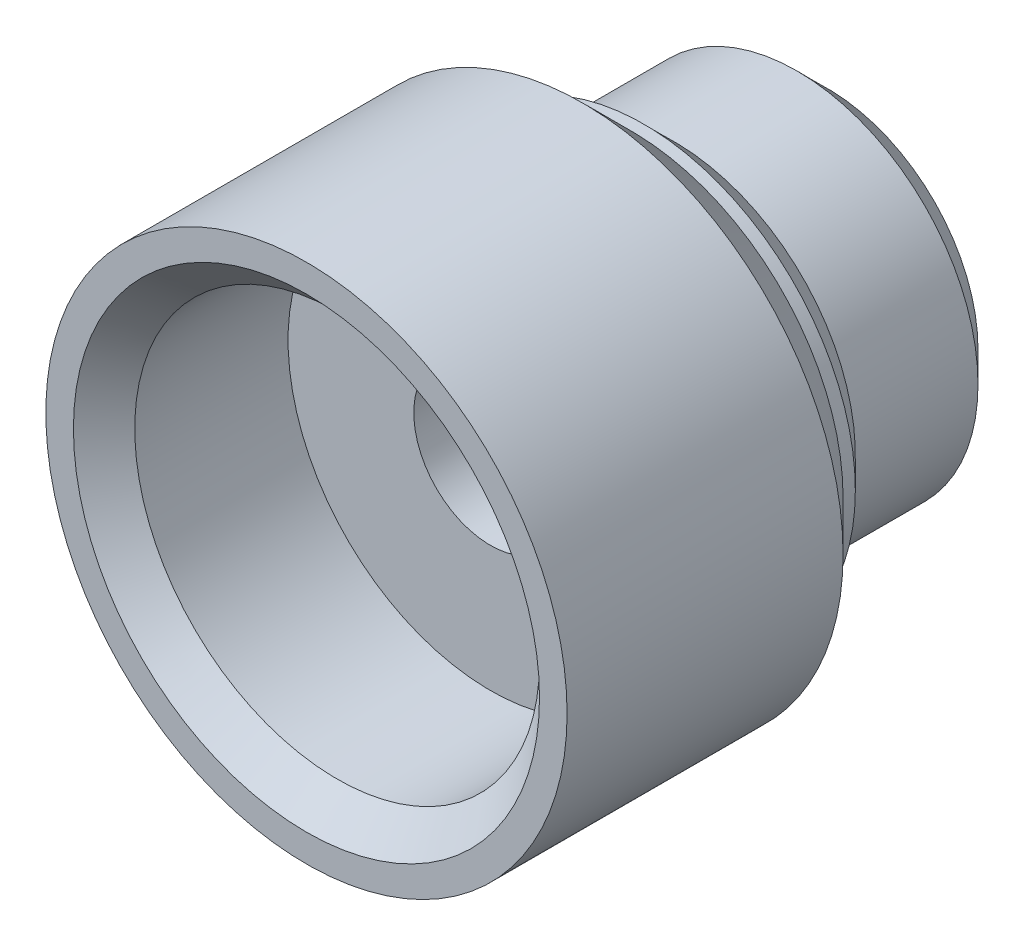
from build123d import *

# Parameters (mm, degrees)
SKETCH1_R           = 2.95
SKETCH1_R_2         = 1.25
BOSS_EXTRUDE1_DEPTH = 3
SKETCH2_R           = 4.25
SKETCH2_R_2         = 1.25
BOSS_EXTRUDE2_DEPTH = 5.5
SKETCH3_R           = 3.3
CUT_EXTRUDE1_DEPTH  = 3
CHAMFER1_SIZE       = 0.5
CHAMFER2_SIZE       = 0.5
BOSS_EXTRUDE3_START = 0.5
SKETCH4_R           = 3.45
SKETCH4_R_2         = 1.25
BOSS_EXTRUDE3_DEPTH = 0.5
CHAMFER3_SIZE       = 1
CHAMFER4_SIZE       = 0.5
CHAMFER6_SIZE       = 0.5


# Some blends are built 0.0001 mm under size
with BuildPart() as part:
    # Sketch1 → Boss-Extrude1 (new body)
    with BuildSketch(Plane.XY):
        Circle(SKETCH1_R)
        Circle(SKETCH1_R_2, mode=Mode.SUBTRACT)
    extrude(amount=BOSS_EXTRUDE1_DEPTH)

    # Sketch2 → Boss-Extrude2 (add)
    with BuildSketch(Plane.XY.offset(3)):
        Circle(SKETCH2_R)
        Circle(SKETCH2_R_2, mode=Mode.SUBTRACT)
    extrude(amount=BOSS_EXTRUDE2_DEPTH)

    # Sketch3 → Cut-Extrude1 (cut)
    with BuildSketch(Plane.XY.offset(8.5)):
        Circle(SKETCH3_R)
    extrude(amount=-CUT_EXTRUDE1_DEPTH, mode=Mode.SUBTRACT)

    # Chamfer1
    chamfer1_edges = [part.edges().sort_by_distance(p)[0] for p in [
        (-3.3, 0, 8.5),
    ]]
    chamfer(chamfer1_edges, length=CHAMFER1_SIZE)

    # Chamfer2
    chamfer2_edges = [part.edges().sort_by_distance(p)[0] for p in [
        (-2.95, 0, 0),
    ]]
    chamfer(chamfer2_edges, length=CHAMFER2_SIZE)

    # Sketch4 → Boss-Extrude3 (add)
    with BuildSketch(Plane(origin=(0, 0, 3), x_dir=(-1, 0, 0), z_dir=(0, 0, -1)).offset(BOSS_EXTRUDE3_START)):
        with Locations(Location((0, 0, 0), (0, 0, 180))):
            Circle(SKETCH4_R)
        with Locations(Location((0, 0, 0), (0, 0, 180))):
            Circle(SKETCH4_R_2, mode=Mode.SUBTRACT)
    extrude(amount=-BOSS_EXTRUDE3_DEPTH)

    # Chamfer3
    # the kernel refuses this chamfer: 1 mm, written as the material it takes off along each edge
    with BuildSketch(Plane(origin=(0, 0, 3), x_dir=(1, 0, 0), z_dir=(0, -1, 0))) as chamfer3_piece_1_section:
        Polygon((4.25 - CHAMFER3_SIZE, 0), (4.25, CHAMFER3_SIZE), (4.25, 0), align=None)
    chamfer3_piece_1 = revolve(axis=Axis((0, 0, 3), (0, 0, 1)), mode=Mode.PRIVATE)
    chamfer3_piece_1 = chamfer3_piece_1 - Plane(origin=(0, 0, 3.597538835), x_dir=(1, 0, 0), z_dir=(0, 0, -1)) * Cylinder(3.45, 17, mode=Mode.PRIVATE)
    add(chamfer3_piece_1, mode=Mode.SUBTRACT)

    # Chamfer4
    chamfer4_edges = [part.edges().sort_by_distance(p)[0] for p in [
        (-1.25, 0, 0),
    ]]
    chamfer(chamfer4_edges, length=CHAMFER4_SIZE)

    # Chamfer6
    chamfer6_edges = [part.edges().sort_by_distance(p)[0] for p in [
        (-3.45, 0, 2.5),
    ]]
    chamfer(chamfer6_edges, length=CHAMFER6_SIZE - 0.0001)  # a hair under: the kernel refuses the full size


solid = part.part
